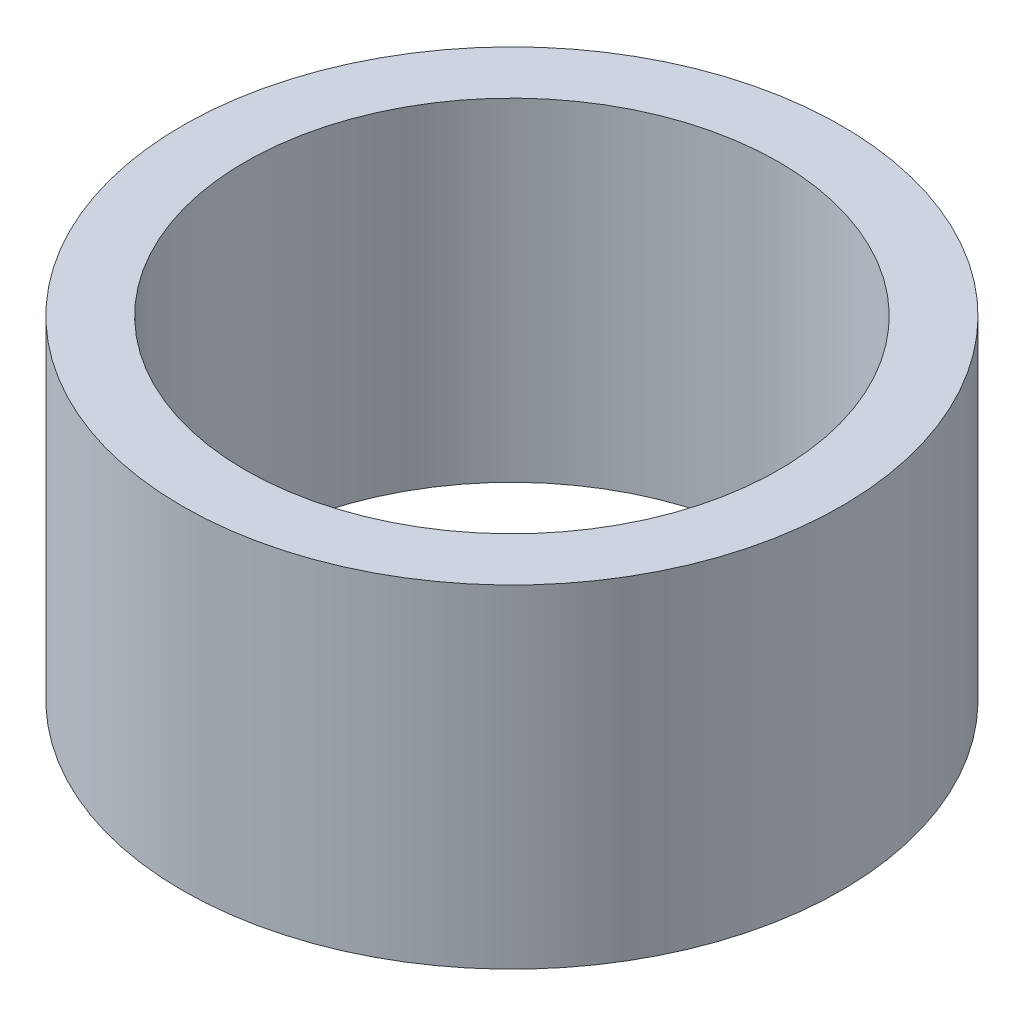
from build123d import *

# Parameters (mm, degrees)
ESQUISSE1_R        = 5.25
ESQUISSE1_R_2      = 4.25
BOSS_EXTRU_1_DEPTH = 5.3


with BuildPart() as part:
    # Esquisse1 → Boss.-Extru.1 (new body)
    with BuildSketch(Plane(origin=(0, 0, 0), x_dir=(1, 0, 0), z_dir=(0, 1, 0))):
        Circle(ESQUISSE1_R)
        Circle(ESQUISSE1_R_2, mode=Mode.SUBTRACT)
    extrude(amount=BOSS_EXTRU_1_DEPTH)


solid = part.part
